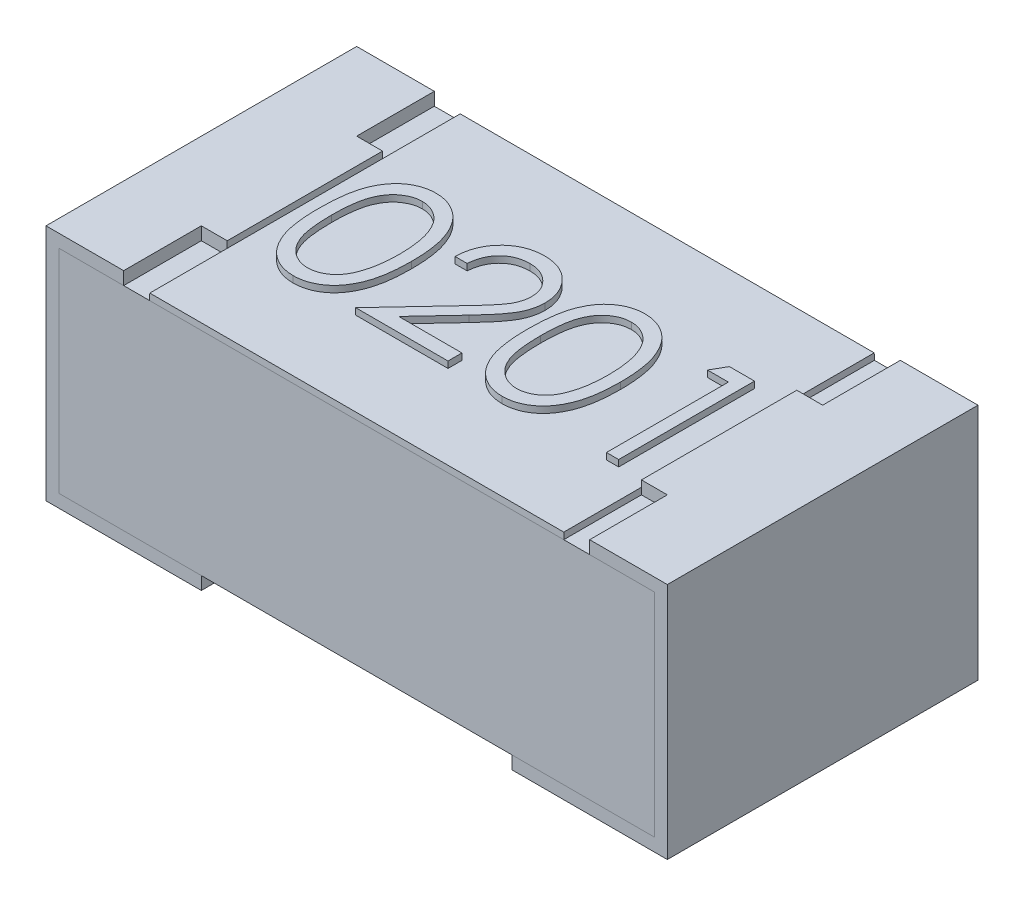
from build123d import *

# Parameters (mm, degrees)
CROQUIS1_W              = 0.6
CROQUIS1_H              = 0.3
SALIENTE_EXTRUIR1_DEPTH = 0.23
CROQUIS2_W              = 0.3
CROQUIS2_H              = 0.0125
CROQUIS2_W_2            = 0.4
CORTAR_EXTRUIR1_DEPTH   = 1.48259714
CROQUIS3_W              = 0.025
CROQUIS3_H              = 0.075
CORTAR_EXTRUIR3_DEPTH   = 0.0125
CROQUIS4_W              = 0.4
CROQUIS4_H              = 0.3
SALIENTE_EXTRUIR2_DEPTH = 0.00625
SALIENTE_EXTRUIR2_TAPER = 1
SALIENTE_EXTRUIR3_START = 0.22375
SALIENTE_EXTRUIR3_DEPTH = 0.00625


# Read off the part's stored shape, not the designer's step: Saliente-Extruir3
with BuildPart() as part:
    # Croquis1 → Saliente-Extruir1 (new body)
    with BuildSketch(Plane(origin=(0, 0, 0), x_dir=(1, 0, 0), z_dir=(0, 1, 0))):
        Rectangle(CROQUIS1_W, CROQUIS1_H)
    extrude(amount=SALIENTE_EXTRUIR1_DEPTH)

    # Croquis2 → Cortar-Extruir1 (cut, through all)
    with BuildSketch(Plane.XY.offset(0.15)):
        with Locations((0, 0.00625)):
            Rectangle(CROQUIS2_W, CROQUIS2_H)
        with Locations((0, 0.22375)):
            Rectangle(CROQUIS2_W_2, CROQUIS2_H)
    extrude(amount=-CORTAR_EXTRUIR1_DEPTH, mode=Mode.SUBTRACT)

    # Croquis3 → Cortar-Extruir3 (cut)
    with BuildSketch(Plane(origin=(0, 0.23, 0), x_dir=(1, 0, 0), z_dir=(0, 1, 0))):
        with Locations((-0.2125, -0.1125)):
            Rectangle(CROQUIS3_W, CROQUIS3_H)
        with Locations((-0.2125, 0.1125)):
            Rectangle(CROQUIS3_W, CROQUIS3_H)
        with Locations((0.2125, 0.1125)):
            Rectangle(CROQUIS3_W, CROQUIS3_H)
        with Locations((0.2125, -0.1125)):
            Rectangle(CROQUIS3_W, CROQUIS3_H)
    extrude(amount=-CORTAR_EXTRUIR3_DEPTH, mode=Mode.SUBTRACT)

    # Croquis4 → Saliente-Extruir2 (add)
    with BuildSketch(Plane(origin=(0, 0.2175, 0), x_dir=(1, 0, 0), z_dir=(0, 1, 0))):
        Rectangle(CROQUIS4_W, CROQUIS4_H)
    extrude(amount=SALIENTE_EXTRUIR2_DEPTH, taper=SALIENTE_EXTRUIR2_TAPER)

    # Saliente-Extruir3 outline → Saliente-Extruir3 (add)
    # profile 1 of 4: a face of its own
    with BuildSketch(Plane(origin=(0, 0, 0), x_dir=(1, 0, 0), z_dir=(0, 1, 0)).offset(SALIENTE_EXTRUIR3_START)):
        with BuildLine():
            add(Edge.make_bspline(
                [(-0.139044614, -0.072311455), (-0.140079193, -0.072293976), (-0.142119182, -0.072259512), (-0.145141968, -0.071902945), (-0.148075929, -0.071329682), (-0.150935543, -0.070527006), (-0.153735482, -0.069544495), (-0.156437591, -0.068264444), (-0.159071915, -0.066790235), (-0.161631426, -0.06511134), (-0.164068028, -0.063187846), (-0.166395432, -0.061060367), (-0.16855517, -0.058675814), (-0.170565332, -0.056071839), (-0.172475799, -0.053272398), (-0.174233174, -0.05023927), (-0.175858677, -0.046984481), (-0.177344483, -0.043487002), (-0.178661825, -0.039695799), (-0.179825468, -0.035567499), (-0.180744238, -0.031065665), (-0.181530662, -0.026226452), (-0.182164974, -0.021029068), (-0.18259802, -0.01547069), (-0.182865671, -0.009554783), (-0.182889473, -0.005496921), (-0.182901703, -0.003411942)],
                knots=[0, 0, 0, 0, 0.033787146, 0.066621658, 0.099284878, 0.131361165, 0.163585188, 0.196103927, 0.228902254, 0.262158056, 0.295991222, 0.330217846, 0.365059826, 0.400950737, 0.437620382, 0.475707529, 0.515380692, 0.556413541, 0.59976483, 0.646424156, 0.696431445, 0.749781518, 0.806573307, 0.867435532, 0.931886753, 1, 1, 1, 1], degree=3))
            add(Edge.make_bspline(
                [(-0.093768542, -0.003411942), (-0.093792962, -0.005417974), (-0.093840545, -0.009326645), (-0.09408711, -0.01504338), (-0.094572789, -0.020440307), (-0.095180326, -0.025530371), (-0.096021769, -0.030292386), (-0.097056388, -0.034742829), (-0.098205137, -0.038900921), (-0.099623154, -0.042732597), (-0.101175193, -0.046291309), (-0.102863824, -0.049614481), (-0.104672937, -0.052731485), (-0.10664392, -0.055617372), (-0.108744756, -0.058292585), (-0.111020408, -0.060709902), (-0.113406729, -0.06292757), (-0.115933291, -0.064900909), (-0.118572257, -0.06662813), (-0.121269224, -0.068172791), (-0.124072043, -0.069418325), (-0.126917198, -0.070487794), (-0.129845384, -0.071304857), (-0.132852953, -0.071869813), (-0.135924605, -0.072266037), (-0.13800101, -0.072296263), (-0.139044614, -0.072311455)],
                knots=[0, 0, 0, 0, 0.06506329, 0.126773166, 0.185515763, 0.240764679, 0.292979796, 0.342250373, 0.388919286, 0.432775664, 0.474628433, 0.514774691, 0.553605893, 0.591426406, 0.62802812, 0.663803634, 0.698984336, 0.733591489, 0.767628469, 0.801208348, 0.83426384, 0.866980695, 0.899719742, 0.932701912, 0.966175883, 1, 1, 1, 1], degree=3))
            add(Edge.make_bspline(
                [(-0.139044614, 0.065592681), (-0.138001363, 0.065574398), (-0.135926666, 0.065538039), (-0.132859356, 0.065188585), (-0.129862908, 0.064608741), (-0.126950096, 0.063787161), (-0.124096995, 0.062767889), (-0.12132592, 0.061490332), (-0.118619658, 0.060003201), (-0.116021216, 0.058255777), (-0.113502068, 0.056307524), (-0.111124091, 0.054105148), (-0.108887068, 0.051670886), (-0.106762924, 0.049030783), (-0.104811924, 0.046134202), (-0.102953953, 0.043031522), (-0.101290925, 0.039668484), (-0.099689265, 0.036101198), (-0.098306771, 0.032230962), (-0.09705998, 0.02807959), (-0.096052578, 0.023598049), (-0.095213447, 0.01880985), (-0.094563375, 0.013697411), (-0.094089914, 0.008271689), (-0.093839812, 0.002529115), (-0.093792712, -0.001397122), (-0.093768542, -0.003411942)],
                knots=[0, 0, 0, 0, 0.033788116, 0.067193932, 0.099862411, 0.132566612, 0.165151173, 0.197913187, 0.231319004, 0.265083278, 0.299255309, 0.334398567, 0.369942824, 0.406283561, 0.44406382, 0.482997707, 0.523354447, 0.56553659, 0.609612924, 0.656390811, 0.705885495, 0.7583245, 0.813831783, 0.872794559, 0.93472223, 1, 1, 1, 1], degree=3))
            add(Edge.make_bspline(
                [(-0.182901703, -0.003411942), (-0.182889409, -0.001309458), (-0.182865528, 0.002774647), (-0.18259986, 0.008725764), (-0.18215853, 0.014308672), (-0.181553714, 0.019523639), (-0.180817699, 0.024372011), (-0.179835164, 0.028840831), (-0.178717805, 0.032950782), (-0.177422808, 0.036715267), (-0.175961578, 0.040185003), (-0.174371177, 0.043424148), (-0.172588488, 0.046427801), (-0.170715394, 0.049243904), (-0.168676075, 0.051826357), (-0.166528564, 0.054211632), (-0.164189043, 0.056344599), (-0.161737043, 0.058287756), (-0.159150363, 0.059991165), (-0.156502734, 0.061491558), (-0.153775933, 0.062773341), (-0.150962515, 0.063781172), (-0.148087766, 0.064613617), (-0.145141639, 0.065182886), (-0.142119267, 0.065541071), (-0.140079222, 0.065575314), (-0.139044614, 0.065592681)],
                knots=[0, 0, 0, 0, 0.068594622, 0.133246042, 0.194312586, 0.251279223, 0.304513439, 0.354234907, 0.400480589, 0.443410755, 0.484014869, 0.523252301, 0.561042373, 0.597900239, 0.633518489, 0.668314351, 0.702495671, 0.736685354, 0.770293169, 0.803437255, 0.835912952, 0.868460246, 0.900846538, 0.933466525, 0.966257575, 1, 1, 1, 1], degree=3))
        make_face()
        with BuildLine():
            add(Edge.make_bspline(
                [(-0.138650452, 0.052138619), (-0.140101293, 0.052062482), (-0.143005618, 0.051910069), (-0.147295032, 0.05083467), (-0.151406661, 0.048960225), (-0.154676455, 0.046900656), (-0.157182455, 0.044939059), (-0.158947075, 0.043238013), (-0.160601637, 0.041377312), (-0.162125829, 0.039338373), (-0.163553384, 0.03714714), (-0.164864443, 0.034786373), (-0.166045687, 0.032244109), (-0.167135751, 0.029522505), (-0.168094198, 0.026539877), (-0.168884782, 0.023250368), (-0.169615141, 0.019635056), (-0.170132176, 0.015672777), (-0.170591811, 0.011389576), (-0.170887198, 0.006769244), (-0.171116992, 0.00181958), (-0.17112518, -0.001598489), (-0.171129398, -0.003359387)],
                knots=[0, 0, 0, 0, 0.060386619, 0.120883249, 0.182754619, 0.24781103, 0.2812991, 0.315087624, 0.349702396, 0.384856581, 0.420966197, 0.458511188, 0.497174722, 0.537602048, 0.580503018, 0.62746754, 0.67838821, 0.733983221, 0.793746705, 0.857713672, 0.926697864, 1, 1, 1, 1], degree=3))
            add(Edge.make_bspline(
                [(-0.105540846, -0.003359387), (-0.105561467, -0.001782729), (-0.105601805, 0.001301551), (-0.105755994, 0.005818472), (-0.106154157, 0.010108629), (-0.106596378, 0.014190504), (-0.107248411, 0.0180415), (-0.107951438, 0.021693857), (-0.108895959, 0.025102326), (-0.10990489, 0.028320272), (-0.111059638, 0.031311135), (-0.112330772, 0.034088858), (-0.113688333, 0.036666853), (-0.115162848, 0.039038045), (-0.116736811, 0.041213057), (-0.118451766, 0.043148279), (-0.120239687, 0.04490369), (-0.12274394, 0.046907423), (-0.126022404, 0.048950476), (-0.130101848, 0.050830647), (-0.134347139, 0.051910358), (-0.137217048, 0.052062587), (-0.138650452, 0.052138619)],
                knots=[0, 0, 0, 0, 0.065681198, 0.128486464, 0.18817513, 0.245106131, 0.299448425, 0.350822936, 0.399941681, 0.446671744, 0.491254533, 0.533376344, 0.573852755, 0.612526312, 0.649597136, 0.685532042, 0.720105786, 0.753837663, 0.818925416, 0.880493462, 0.940311334, 1, 1, 1, 1], degree=3))
            add(Edge.make_bspline(
                [(-0.110507287, -0.036337606), (-0.110111815, -0.035167141), (-0.109308838, -0.032790595), (-0.108273972, -0.029104007), (-0.107458972, -0.025236053), (-0.106725754, -0.021209848), (-0.106225292, -0.016995701), (-0.105822473, -0.012606651), (-0.105585204, -0.008039388), (-0.105555792, -0.0049363), (-0.105540846, -0.003359387)],
                knots=[0, 0, 0, 0, 0.110588339, 0.224541754, 0.342503494, 0.464324098, 0.590756033, 0.722227475, 0.858842836, 1, 1, 1, 1], degree=3))
            add(Edge.make_bspline(
                [(-0.138650452, -0.058857393), (-0.137197846, -0.058797509), (-0.134295634, -0.058677866), (-0.130055473, -0.057523555), (-0.125939126, -0.055781915), (-0.12271322, -0.053722528), (-0.120258989, -0.051761305), (-0.118500579, -0.050089185), (-0.116886649, -0.048216881), (-0.115355922, -0.04619678), (-0.113951987, -0.043990288), (-0.112675328, -0.041608015), (-0.11151035, -0.039043346), (-0.11084663, -0.037252976), (-0.110507287, -0.036337606)],
                knots=[0, 0, 0, 0, 0.112813401, 0.225393884, 0.339594815, 0.45967541, 0.52173519, 0.583925839, 0.648174145, 0.713881038, 0.781004455, 0.851450928, 0.924050693, 1, 1, 1, 1], degree=3))
            add(Edge.make_bspline(
                [(-0.171129398, -0.003359387), (-0.171124922, -0.00511149), (-0.171116233, -0.008511977), (-0.170889252, -0.013453353), (-0.17058004, -0.018062179), (-0.170181213, -0.022344307), (-0.169588931, -0.026285243), (-0.168925296, -0.02991209), (-0.168117691, -0.033205657), (-0.167162159, -0.036188542), (-0.166073797, -0.038911369), (-0.164885488, -0.041445007), (-0.16360892, -0.043819385), (-0.162180246, -0.046013176), (-0.160624296, -0.048033534), (-0.158976214, -0.049916219), (-0.157174494, -0.051595173), (-0.154681988, -0.053608811), (-0.151391449, -0.055689622), (-0.147245486, -0.057501594), (-0.142985286, -0.058640303), (-0.140093721, -0.058785114), (-0.138650452, -0.058857393)],
                knots=[0, 0, 0, 0, 0.072951066, 0.141583694, 0.20592646, 0.265301357, 0.320597233, 0.371816503, 0.41878977, 0.461698729, 0.502133582, 0.540804315, 0.578180525, 0.614296865, 0.649678243, 0.68429946, 0.718358953, 0.752080865, 0.817652439, 0.879722076, 0.93996556, 1, 1, 1, 1], degree=3))
        make_face(mode=Mode.SUBTRACT)
    # profile 2 of 4: a face of its own
    with BuildSketch(Plane(origin=(0, 0, 0), x_dir=(1, 0, 0), z_dir=(0, 1, 0)).offset(SALIENTE_EXTRUIR3_START)):
        with BuildLine():
            add(Edge.make_bspline(
                [(-0.034775633, 0.052138619), (-0.035801469, 0.05211182), (-0.037816042, 0.052059192), (-0.040773862, 0.051691046), (-0.043595511, 0.05105593), (-0.046288086, 0.050187288), (-0.048856143, 0.049083206), (-0.051287194, 0.047708029), (-0.05357578, 0.04606706), (-0.055726205, 0.044206573), (-0.057707503, 0.042135189), (-0.059448294, 0.039826099), (-0.060969349, 0.037321463), (-0.062296458, 0.034628039), (-0.063374197, 0.031721387), (-0.064197733, 0.028611826), (-0.064849377, 0.025312858), (-0.065067076, 0.023034683), (-0.06517866, 0.021866979)],
                knots=[0, 0, 0, 0, 0.064438672, 0.126546911, 0.186887153, 0.245877536, 0.304040885, 0.362191218, 0.420975933, 0.480660283, 0.540600275, 0.600689098, 0.66193579, 0.724442506, 0.789038394, 0.856313757, 0.926352028, 1, 1, 1, 1], degree=3))
            add(Edge.make_bspline(
                [(-0.006317138, 0.025545824), (-0.006340965, 0.026440879), (-0.006387924, 0.028204861), (-0.006802357, 0.03079114), (-0.007428653, 0.033285934), (-0.008326102, 0.035696917), (-0.009510696, 0.03799985), (-0.010952647, 0.040197534), (-0.01261635, 0.042322189), (-0.014540953, 0.044314331), (-0.01665521, 0.046138862), (-0.018888753, 0.047755117), (-0.021251819, 0.049105834), (-0.023734444, 0.050213099), (-0.026329707, 0.051081693), (-0.029042627, 0.051683556), (-0.031865709, 0.052061439), (-0.033793394, 0.052112567), (-0.034775633, 0.052138619)],
                knots=[0, 0, 0, 0, 0.061965401, 0.122121906, 0.180988497, 0.239933216, 0.299905831, 0.359988847, 0.421775742, 0.486575826, 0.551534805, 0.615017543, 0.677258617, 0.739729962, 0.803050103, 0.866495132, 0.931973474, 1, 1, 1, 1], degree=3))
            add(Edge.make_bspline(
                [(-0.031123065, -0.014658697), (-0.029884458, -0.013365729), (-0.027505346, -0.010882202), (-0.02414037, -0.007256356), (-0.021118087, -0.003892617), (-0.018418935, -0.000797342), (-0.016101466, 0.002074746), (-0.0140449, 0.004630627), (-0.012397106, 0.006982612), (-0.010608773, 0.00970887), (-0.008876711, 0.013037482), (-0.007388325, 0.017105235), (-0.006480772, 0.02129268), (-0.006371901, 0.024122434), (-0.006317138, 0.025545824)],
                knots=[0, 0, 0, 0, 0.110802644, 0.212829202, 0.30610131, 0.390647321, 0.466924469, 0.534481039, 0.593586941, 0.644557005, 0.736200453, 0.825024026, 0.911985585, 1, 1, 1, 1], degree=3))
            Line((-0.031123065, -0.014658697), (-0.081996237, -0.06894794))
            Line((-0.081996237, -0.06894794), (0.007136924, -0.06894794))
            Line((0.007136924, -0.06894794), (0.007136924, -0.055493877))
            Line((0.007136924, -0.055493877), (-0.053905627, -0.055493877))
            Line((-0.053905627, -0.055493877), (-0.021085074, -0.020466017))
            add(Edge.make_bspline(
                [(0.005455166, 0.026596923), (0.005391704, 0.024769894), (0.005265893, 0.021147899), (0.004189702, 0.0158253), (0.002508892, 0.010668412), (0.000485116, 0.00651807), (-0.001556466, 0.003173672), (-0.003396225, 0.000420126), (-0.005549959, -0.002544682), (-0.008049014, -0.005710823), (-0.010841695, -0.009103096), (-0.013953297, -0.012719454), (-0.017406009, -0.016522532), (-0.019829356, -0.019120049), (-0.021085074, -0.020466017)],
                knots=[0, 0, 0, 0, 0.098702196, 0.195672309, 0.292422427, 0.391342544, 0.444462441, 0.504228775, 0.570352338, 0.642545753, 0.722287505, 0.807921123, 0.900469538, 1, 1, 1, 1], degree=3))
            add(Edge.make_bspline(
                [(-0.034171251, 0.065592681), (-0.032732873, 0.065559008), (-0.02990651, 0.06549284), (-0.025781477, 0.064924618), (-0.021854511, 0.064034653), (-0.018133287, 0.062786018), (-0.014647497, 0.061107535), (-0.011370954, 0.059091248), (-0.008264649, 0.0567593), (-0.005468449, 0.054013808), (-0.002900823, 0.051082847), (-0.000685719, 0.047953789), (0.00121122, 0.044721987), (0.00279238, 0.041362796), (0.003956338, 0.037844588), (0.00484003, 0.034218583), (0.00533953, 0.030447248), (0.005416191, 0.02789467), (0.005455166, 0.026596923)],
                knots=[0, 0, 0, 0, 0.06947546, 0.136516798, 0.200788824, 0.263829673, 0.325735023, 0.387290692, 0.449509219, 0.51296782, 0.576275215, 0.6375801, 0.697902606, 0.757172088, 0.816598528, 0.876653171, 0.937289642, 1, 1, 1, 1], degree=3))
            add(Edge.make_bspline(
                [(-0.076950964, 0.021866979), (-0.076874238, 0.02342877), (-0.076723551, 0.026496084), (-0.076017883, 0.030968246), (-0.075008161, 0.035242925), (-0.073580525, 0.0392858), (-0.071807525, 0.043132618), (-0.06968133, 0.046768098), (-0.06716296, 0.050178373), (-0.064306795, 0.053331827), (-0.061204695, 0.056224753), (-0.057857582, 0.058722937), (-0.054340348, 0.060833677), (-0.050663664, 0.062598243), (-0.046786047, 0.063922751), (-0.042742687, 0.064905516), (-0.038515818, 0.065496801), (-0.035635918, 0.065560357), (-0.034171251, 0.065592681)],
                knots=[0, 0, 0, 0, 0.068790794, 0.135103289, 0.198978674, 0.2619043, 0.323494969, 0.385195378, 0.446969239, 0.509764777, 0.572250569, 0.633405176, 0.693251163, 0.752583163, 0.812579266, 0.873275085, 0.935549943, 1, 1, 1, 1], degree=3))
            Line((-0.076950964, 0.021866979), (-0.06517866, 0.021866979))
        make_face()
    # profile 3 of 4: a face of its own
    with BuildSketch(Plane(origin=(0, 0, 0), x_dir=(1, 0, 0), z_dir=(0, 1, 0)).offset(SALIENTE_EXTRUIR3_START)):
        with BuildLine():
            add(Edge.make_bspline(
                [(0.062766317, -0.072311455), (0.061731738, -0.072293976), (0.059691749, -0.072259512), (0.056668963, -0.071902945), (0.053735002, -0.071329682), (0.050875388, -0.070527006), (0.048075449, -0.069544495), (0.04537334, -0.068264444), (0.042739016, -0.066790235), (0.040179505, -0.06511134), (0.037742903, -0.063187846), (0.035415498, -0.061060367), (0.03325576, -0.058675814), (0.031245599, -0.056071839), (0.029335132, -0.053272398), (0.027577757, -0.05023927), (0.025952253, -0.046984481), (0.024466448, -0.043487002), (0.023149105, -0.039695799), (0.021985463, -0.035567499), (0.021066693, -0.031065665), (0.020280269, -0.026226452), (0.019645957, -0.021029068), (0.01921291, -0.01547069), (0.01894526, -0.009554783), (0.018921458, -0.005496921), (0.018909228, -0.003411942)],
                knots=[0, 0, 0, 0, 0.033787146, 0.066621658, 0.099284878, 0.131361165, 0.163585188, 0.196103927, 0.228902254, 0.262158056, 0.295991222, 0.330217846, 0.365059826, 0.400950737, 0.437620382, 0.475707529, 0.515380692, 0.556413541, 0.59976483, 0.646424156, 0.696431445, 0.749781518, 0.806573307, 0.867435532, 0.931886753, 1, 1, 1, 1], degree=3))
            add(Edge.make_bspline(
                [(0.108042389, -0.003411942), (0.108017968, -0.005417974), (0.107970385, -0.009326645), (0.107723821, -0.01504338), (0.107238142, -0.020440307), (0.106630605, -0.025530371), (0.105789162, -0.030292386), (0.104754543, -0.034742829), (0.103605794, -0.038900921), (0.102187777, -0.042732597), (0.100635738, -0.046291309), (0.098947107, -0.049614481), (0.097137993, -0.052731485), (0.095167011, -0.055617372), (0.093066175, -0.058292585), (0.090790523, -0.060709902), (0.088404202, -0.06292757), (0.08587764, -0.064900909), (0.083238673, -0.06662813), (0.080541707, -0.068172791), (0.077738887, -0.069418325), (0.074893733, -0.070487794), (0.071965546, -0.071304857), (0.068957978, -0.071869813), (0.065886326, -0.072266037), (0.063809921, -0.072296263), (0.062766317, -0.072311455)],
                knots=[0, 0, 0, 0, 0.06506329, 0.126773166, 0.185515763, 0.240764679, 0.292979796, 0.342250373, 0.388919286, 0.432775664, 0.474628433, 0.514774691, 0.553605893, 0.591426406, 0.62802812, 0.663803634, 0.698984336, 0.733591489, 0.767628469, 0.801208348, 0.83426384, 0.866980695, 0.899719742, 0.932701912, 0.966175883, 1, 1, 1, 1], degree=3))
            add(Edge.make_bspline(
                [(0.062766317, 0.065592681), (0.063809568, 0.065574398), (0.065884265, 0.065538039), (0.068951575, 0.065188585), (0.071948023, 0.064608741), (0.074860834, 0.063787161), (0.077713936, 0.062767889), (0.080485011, 0.061490332), (0.083191273, 0.060003201), (0.085789715, 0.058255777), (0.088308863, 0.056307524), (0.09068684, 0.054105148), (0.092923863, 0.051670886), (0.095048006, 0.049030783), (0.096999007, 0.046134202), (0.098856978, 0.043031522), (0.100520005, 0.039668484), (0.102121666, 0.036101198), (0.103504159, 0.032230962), (0.104750951, 0.02807959), (0.105758352, 0.023598049), (0.106597484, 0.01880985), (0.107247556, 0.013697411), (0.107721017, 0.008271689), (0.107971119, 0.002529115), (0.108018219, -0.001397122), (0.108042389, -0.003411942)],
                knots=[0, 0, 0, 0, 0.033788116, 0.067193932, 0.099862411, 0.132566612, 0.165151173, 0.197913187, 0.231319004, 0.265083278, 0.299255309, 0.334398567, 0.369942824, 0.406283561, 0.44406382, 0.482997707, 0.523354447, 0.56553659, 0.609612924, 0.656390811, 0.705885495, 0.7583245, 0.813831783, 0.872794559, 0.93472223, 1, 1, 1, 1], degree=3))
            add(Edge.make_bspline(
                [(0.018909228, -0.003411942), (0.018921522, -0.001309458), (0.018945403, 0.002774647), (0.019211071, 0.008725764), (0.019652401, 0.014308672), (0.020257217, 0.019523639), (0.020993232, 0.024372011), (0.021975767, 0.028840831), (0.023093126, 0.032950782), (0.024388123, 0.036715267), (0.025849353, 0.040185003), (0.027439754, 0.043424148), (0.029222443, 0.046427801), (0.031095536, 0.049243904), (0.033134856, 0.051826357), (0.035282367, 0.054211632), (0.037621887, 0.056344599), (0.040073888, 0.058287756), (0.042660568, 0.059991165), (0.045308196, 0.061491558), (0.048034998, 0.062773341), (0.050848416, 0.063781172), (0.053723164, 0.064613617), (0.056669292, 0.065182886), (0.059691664, 0.065541071), (0.061731709, 0.065575314), (0.062766317, 0.065592681)],
                knots=[0, 0, 0, 0, 0.068594622, 0.133246042, 0.194312586, 0.251279223, 0.304513439, 0.354234907, 0.400480589, 0.443410755, 0.484014869, 0.523252301, 0.561042373, 0.597900239, 0.633518489, 0.668314351, 0.702495671, 0.736685354, 0.770293169, 0.803437255, 0.835912952, 0.868460246, 0.900846538, 0.933466525, 0.966257575, 1, 1, 1, 1], degree=3))
        make_face()
        with BuildLine():
            add(Edge.make_bspline(
                [(0.063160479, 0.052138619), (0.061709638, 0.052062482), (0.058805313, 0.051910069), (0.054515898, 0.05083467), (0.05040427, 0.048960225), (0.047134475, 0.046900656), (0.044628476, 0.044939059), (0.042863856, 0.043238013), (0.041209294, 0.041377312), (0.039685102, 0.039338373), (0.038257547, 0.03714714), (0.036946488, 0.034786373), (0.035765244, 0.032244109), (0.03467518, 0.029522505), (0.033716733, 0.026539877), (0.032926149, 0.023250368), (0.03219579, 0.019635056), (0.031678755, 0.015672777), (0.031219119, 0.011389576), (0.030923733, 0.006769244), (0.030693938, 0.00181958), (0.030685751, -0.001598489), (0.030681532, -0.003359387)],
                knots=[0, 0, 0, 0, 0.060386619, 0.120883249, 0.182754619, 0.24781103, 0.2812991, 0.315087624, 0.349702396, 0.384856581, 0.420966197, 0.458511188, 0.497174722, 0.537602048, 0.580503018, 0.62746754, 0.67838821, 0.733983221, 0.793746705, 0.857713672, 0.926697864, 1, 1, 1, 1], degree=3))
            add(Edge.make_bspline(
                [(0.096270085, -0.003359387), (0.096249464, -0.001782729), (0.096209126, 0.001301551), (0.096054937, 0.005818472), (0.095656774, 0.010108629), (0.095214553, 0.014190504), (0.09456252, 0.0180415), (0.093859492, 0.021693857), (0.092914972, 0.025102326), (0.091906041, 0.028320272), (0.090751293, 0.031311135), (0.089480159, 0.034088858), (0.088122598, 0.036666853), (0.086648083, 0.039038045), (0.085074119, 0.041213057), (0.083359164, 0.043148279), (0.081571244, 0.04490369), (0.079066991, 0.046907423), (0.075788527, 0.048950476), (0.071709082, 0.050830647), (0.067463792, 0.051910358), (0.064593882, 0.052062587), (0.063160479, 0.052138619)],
                knots=[0, 0, 0, 0, 0.065681198, 0.128486464, 0.18817513, 0.245106131, 0.299448425, 0.350822936, 0.399941681, 0.446671744, 0.491254533, 0.533376344, 0.573852755, 0.612526312, 0.649597136, 0.685532042, 0.720105786, 0.753837663, 0.818925416, 0.880493462, 0.940311334, 1, 1, 1, 1], degree=3))
            add(Edge.make_bspline(
                [(0.091303644, -0.036337606), (0.091699115, -0.035167141), (0.092502092, -0.032790595), (0.093536959, -0.029104007), (0.094351958, -0.025236053), (0.095085177, -0.021209848), (0.095585639, -0.016995701), (0.095988458, -0.012606651), (0.096225727, -0.008039388), (0.096255138, -0.0049363), (0.096270085, -0.003359387)],
                knots=[0, 0, 0, 0, 0.110588339, 0.224541754, 0.342503494, 0.464324098, 0.590756033, 0.722227475, 0.858842836, 1, 1, 1, 1], degree=3))
            add(Edge.make_bspline(
                [(0.063160479, -0.058857393), (0.064613084, -0.058797509), (0.067515296, -0.058677866), (0.071755457, -0.057523555), (0.075871805, -0.055781915), (0.07909771, -0.053722528), (0.081551942, -0.051761305), (0.083310352, -0.050089185), (0.084924282, -0.048216881), (0.086455009, -0.04619678), (0.087858944, -0.043990288), (0.089135602, -0.041608015), (0.09030058, -0.039043346), (0.090964301, -0.037252976), (0.091303644, -0.036337606)],
                knots=[0, 0, 0, 0, 0.112813401, 0.225393884, 0.339594815, 0.45967541, 0.52173519, 0.583925839, 0.648174145, 0.713881038, 0.781004455, 0.851450928, 0.924050693, 1, 1, 1, 1], degree=3))
            add(Edge.make_bspline(
                [(0.030681532, -0.003359387), (0.030686009, -0.00511149), (0.030694698, -0.008511977), (0.030921679, -0.013453353), (0.031230891, -0.018062179), (0.031629718, -0.022344307), (0.032221999, -0.026285243), (0.032885635, -0.02991209), (0.03369324, -0.033205657), (0.034648772, -0.036188542), (0.035737133, -0.038911369), (0.036925443, -0.041445007), (0.038202011, -0.043819385), (0.039630685, -0.046013176), (0.041186635, -0.048033534), (0.042834716, -0.049916219), (0.044636437, -0.051595173), (0.047128942, -0.053608811), (0.050419482, -0.055689622), (0.054565445, -0.057501594), (0.058825644, -0.058640303), (0.061717209, -0.058785114), (0.063160479, -0.058857393)],
                knots=[0, 0, 0, 0, 0.072951066, 0.141583694, 0.20592646, 0.265301357, 0.320597233, 0.371816503, 0.41878977, 0.461698729, 0.502133582, 0.540804315, 0.578180525, 0.614296865, 0.649678243, 0.68429946, 0.718358953, 0.752080865, 0.817652439, 0.879722076, 0.93996556, 1, 1, 1, 1], degree=3))
        make_face(mode=Mode.SUBTRACT)
    # profile 4 of 4: a face of its own
    with BuildSketch(Plane(origin=(0, 0, 0), x_dir=(1, 0, 0), z_dir=(0, 1, 0)).offset(SALIENTE_EXTRUIR3_START)):
        Polygon((0.16017688, 0.048775103), (0.16017688, -0.06894794), (0.171949184, -0.06894794), (0.171949184, 0.062229165), (0.147695084, 0.062229165), (0.139995786, 0.048775103), align=None)
    extrude(amount=SALIENTE_EXTRUIR3_DEPTH)


solid = part.part
